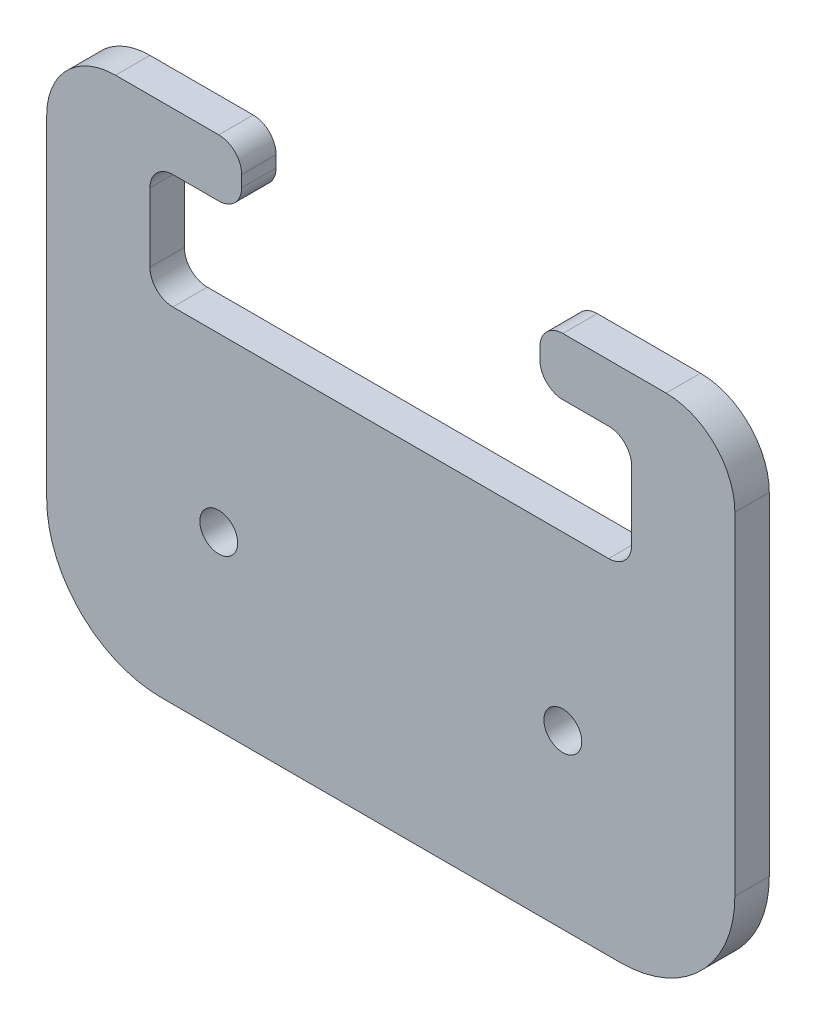
from build123d import *

# Parameters (mm, degrees)
EXTRUDE_1_DEPTH     = 3
FILLET_1_R          = 6
FILLET_2_R          = 2
SKETCH_2_R          = 1.65
CUT_EXTRUDE_1_DEPTH = 5
FILLET_3_R          = 10


with BuildPart() as part:
    # 草图1 → 凸台-拉伸1 (new body)
    with BuildSketch(Plane.XY):
        Polygon((13, 22.5), (30, 22.5), (30, -22.5), (-30, -22.5), (-30, 22.5), (-13, 22.5), (-13, 17.5), (-21, 17.5), (-21, 7.5), (21, 7.5), (21, 17.5), (13, 17.5), align=None)
    extrude(amount=EXTRUDE_1_DEPTH)

    # 圆角1
    fillet_1_edges = [part.edges().sort_by_distance(p)[0] for p in [
        (30, 22.5, 1.5),
        (-30, 22.5, 1.5),
    ]]
    fillet(fillet_1_edges, radius=FILLET_1_R)

    # 圆角2
    fillet_2_edges = [part.edges().sort_by_distance(p)[0] for p in [
        (21, 17.5, 1.5),
        (21, 7.5, 1.5),
        (-21, 7.5, 1.5),
        (-21, 17.5, 1.5),
        (-13, 17.5, 1.5),
        (-13, 22.5, 1.5),
        (13, 17.5, 1.5),
        (13, 22.5, 1.5),
    ]]
    fillet(fillet_2_edges, radius=FILLET_2_R)

    # 草图2 → 切除-拉伸1 (cut)
    with BuildSketch(Plane.XY.offset(3)):
        with Locations((-15, -7.5)):
            Circle(SKETCH_2_R)
        with Locations((15, -7.5)):
            Circle(SKETCH_2_R)
    extrude(amount=-CUT_EXTRUDE_1_DEPTH, mode=Mode.SUBTRACT)

    # 圆角3
    fillet_3_edges = [part.edges().sort_by_distance(p)[0] for p in [
        (-30, -22.5, 1.5),
        (30, -22.5, 1.5),
    ]]
    fillet(fillet_3_edges, radius=FILLET_3_R)


solid = part.part
